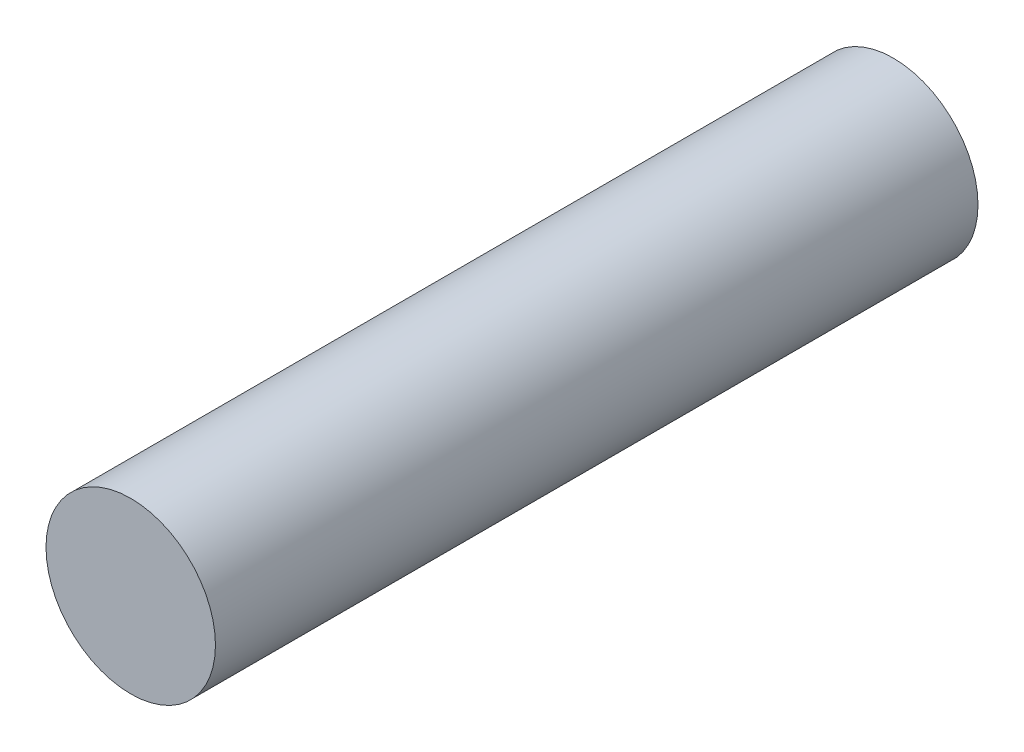
from build123d import *

# Parameters (mm, degrees)
SKETCH2_R           = 30
BOSS_EXTRUDE1_DEPTH = 270


with BuildPart() as part:
    # Sketch2 → Boss-Extrude1 (new body)
    with BuildSketch(Plane.XY):
        Circle(SKETCH2_R)
    extrude(amount=BOSS_EXTRUDE1_DEPTH)


solid = part.part
